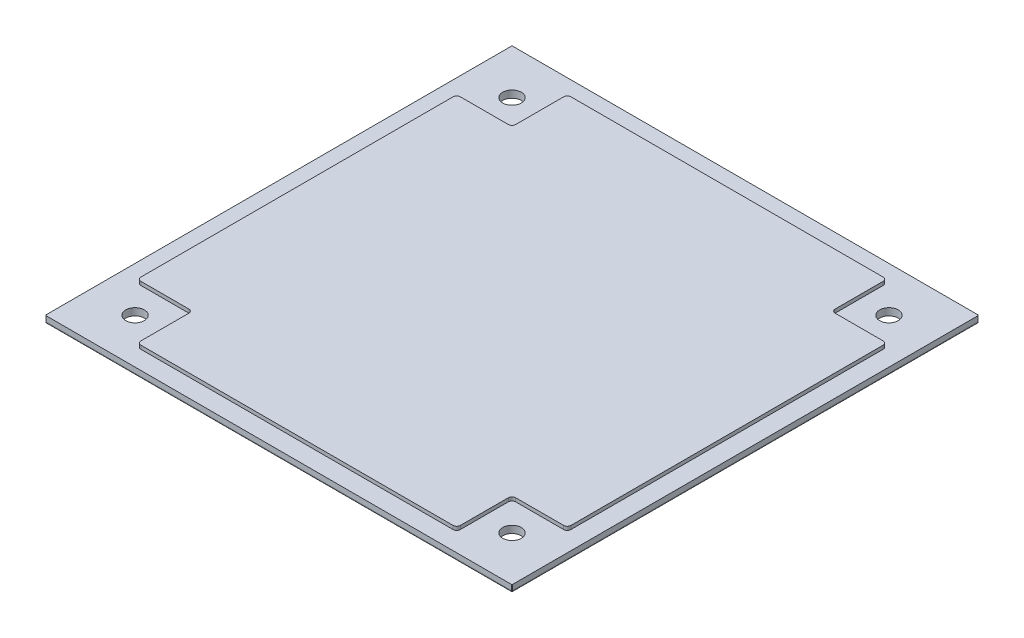
from build123d import *

# Parameters (mm, degrees)
SKETCH_1_W          = 130
SKETCH_1_H          = 130
EXTRUDE_1_DEPTH     = 3
SKETCH_2_R          = 2.6
CUT_EXTRUDE_1_DEPTH = 92.972822073
SKETCH_4_W          = 20.5
SKETCH_4_H          = 20.5
CUT_EXTRUDE_2_DEPTH = 1
SKETCH_5_W          = 89
SKETCH_5_H          = 5.1
SKETCH_5_W_2        = 5.1
SKETCH_5_H_2        = 89
CUT_EXTRUDE_3_DEPTH = 1
CHAMFER_1_SIZE      = 0.2
FILLET_1_R          = 0.5
FILLET_2_R          = 1


with BuildPart() as part:
    # 草图1 → 凸台-拉伸1 (new body)
    with BuildSketch(Plane(origin=(0, 0, 0), x_dir=(1, 0, 0), z_dir=(0, 1, 0))):
        Rectangle(SKETCH_1_W, SKETCH_1_H)
    extrude(amount=EXTRUDE_1_DEPTH)

    # 草图2 → 切除-拉伸1 (cut, through all)
    with BuildSketch(Plane(origin=(0, 3, 0), x_dir=(1, 0, 0), z_dir=(0, 1, 0))):
        with Locations(Location((52.5, 52.5, 0), (0, 0, 270))):
            Circle(SKETCH_2_R)
        with Locations(Location((52.5, -52.5, 0), (0, 0, 270))):
            Circle(SKETCH_2_R)
        with Locations(Location((-52.5, -52.5, 0), (0, 0, 270))):
            Circle(SKETCH_2_R)
        with Locations(Location((-52.5, 52.5, 0), (0, 0, 270))):
            Circle(SKETCH_2_R)
    extrude(amount=-CUT_EXTRUDE_1_DEPTH, mode=Mode.SUBTRACT)

    # 草图4 → 切除-拉伸2 (cut)
    with BuildSketch(Plane(origin=(0, 3, 0), x_dir=(1, 0, 0), z_dir=(0, 1, 0))):
        with Locations((54.75, 54.75)):
            Rectangle(SKETCH_4_W, SKETCH_4_H)
        with Locations((54.75, -54.75)):
            Rectangle(SKETCH_4_W, SKETCH_4_H)
        with Locations((-54.75, -54.75)):
            Rectangle(SKETCH_4_W, SKETCH_4_H)
        with Locations((-54.75, 54.75)):
            Rectangle(SKETCH_4_W, SKETCH_4_H)
    extrude(amount=-CUT_EXTRUDE_2_DEPTH, mode=Mode.SUBTRACT)

    # 草图5 → 切除-拉伸3 (cut)
    with BuildSketch(Plane(origin=(0, 3, 0), x_dir=(1, 0, 0), z_dir=(0, 1, 0))):
        with Locations((0, 62.45)):
            Rectangle(SKETCH_5_W, SKETCH_5_H)
        with Locations((62.45, 0)):
            Rectangle(SKETCH_5_W_2, SKETCH_5_H_2)
        with Locations((0, -62.45)):
            Rectangle(SKETCH_5_W, SKETCH_5_H)
        with Locations((-62.45, 0)):
            Rectangle(SKETCH_5_W_2, SKETCH_5_H_2)
    extrude(amount=-CUT_EXTRUDE_3_DEPTH, mode=Mode.SUBTRACT)

    # 倒角1
    chamfer_1_edges = [part.edges().sort_by_distance(p)[0] for p in [
        (65, 1, 65),
        (-65, 1, 65),
        (-65, 1, -65),
        (65, 1, -65),
    ]]
    chamfer(chamfer_1_edges, length=CHAMFER_1_SIZE)

    # 圆角1
    # the kernel refuses this fillet: 0.5 mm, written as the material it takes off along each edge
    with BuildSketch(Plane(origin=(-65, 0, 66.05), x_dir=(1, 0, 0), z_dir=(0, 0, -1)), Plane(origin=(66.05, 0, 65), x_dir=(0, 0, -1), z_dir=(-1, 0, 0)), Plane(origin=(65, 0, -66.05), x_dir=(-1, 0, 0), z_dir=(0, 0, 1))) as fillet_1_piece_1:
        with BuildLine():
            CenterArc((FILLET_1_R, -FILLET_1_R), FILLET_1_R, 90, 90)
            Line((0, -FILLET_1_R), (0, 0))
            Line((0, 0), (FILLET_1_R, 0))
        make_face()
    extrude(amount=132.1, mode=Mode.SUBTRACT)
    with BuildSketch(Plane(origin=(-66.05, 0, -65), x_dir=(0, 1, 0), z_dir=(1, 0, 0))) as fillet_1_piece_2:
        with BuildLine():
            CenterArc((FILLET_1_R, FILLET_1_R), FILLET_1_R, 180, 90)
            Line((0, FILLET_1_R), (0, 0))
            Line((0, 0), (FILLET_1_R, 0))
        make_face()
    extrude(amount=132.1, mode=Mode.SUBTRACT)

    # 圆角2
    fillet_2_edges = [part.edges().sort_by_distance(p)[0] for p in [
        (-44.5, 2.5, -59.9),
        (44.5, 2.5, -59.9),
        (59.9, 2.5, -44.5),
        (59.9, 2.5, 44.5),
        (44.5, 2.5, 59.9),
        (-44.5, 2.5, 59.9),
        (-59.9, 2.5, 44.5),
        (-59.9, 2.5, -44.5),
        (-44.5, 2.5, -44.5),
        (-44.5, 2.5, 44.5),
        (44.5, 2.5, 44.5),
        (44.5, 2.5, -44.5),
    ]]
    fillet(fillet_2_edges, radius=FILLET_2_R)


solid = part.part
